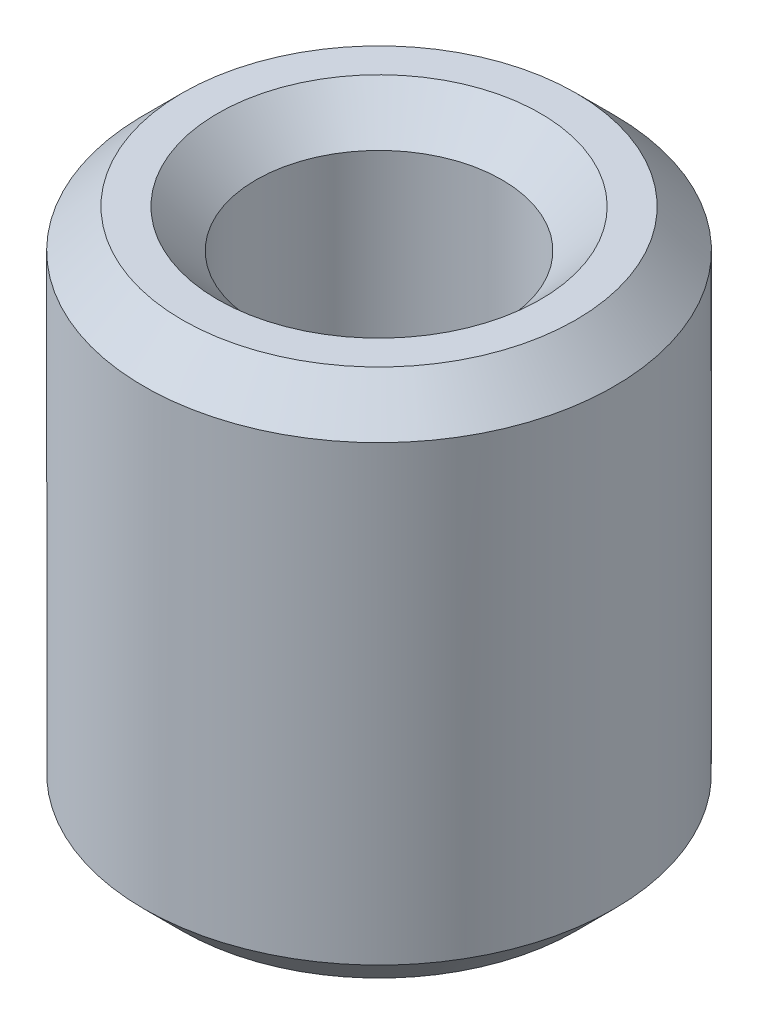
from build123d import *

# Parameters (mm, degrees)
SKETCH1_R           = 22.5
BOSS_EXTRUDE1_DEPTH = 50.658972649
SKETCH2_R           = 11.768922489
CUT_EXTRUDE1_DEPTH  = 60.82333583
CHAMFER1_SIZE       = 3.673850992


with BuildPart() as part:
    # Sketch1 → Boss-Extrude1 (new body)
    with BuildSketch(Plane(origin=(0, 0, 0), x_dir=(1, 0, 0), z_dir=(0, 1, 0))):
        Circle(SKETCH1_R)
    extrude(amount=BOSS_EXTRUDE1_DEPTH)

    # Sketch2 → Cut-Extrude1 (cut, through all)
    with BuildSketch(Plane(origin=(0, 0, 0), x_dir=(1, 0, 0), z_dir=(0, 1, 0))):
        Circle(SKETCH2_R)
    extrude(amount=CUT_EXTRUDE1_DEPTH, mode=Mode.SUBTRACT)

    # Chamfer1
    chamfer1_edges = [part.edges().sort_by_distance(p)[0] for p in [
        (-11.768922489, 50.658972649, 0),
        (-11.768922489, 0, 0),
        (-22.5, 0, 0),
        (-22.5, 50.658972649, 0),
    ]]
    chamfer(chamfer1_edges, length=CHAMFER1_SIZE)


solid = part.part
